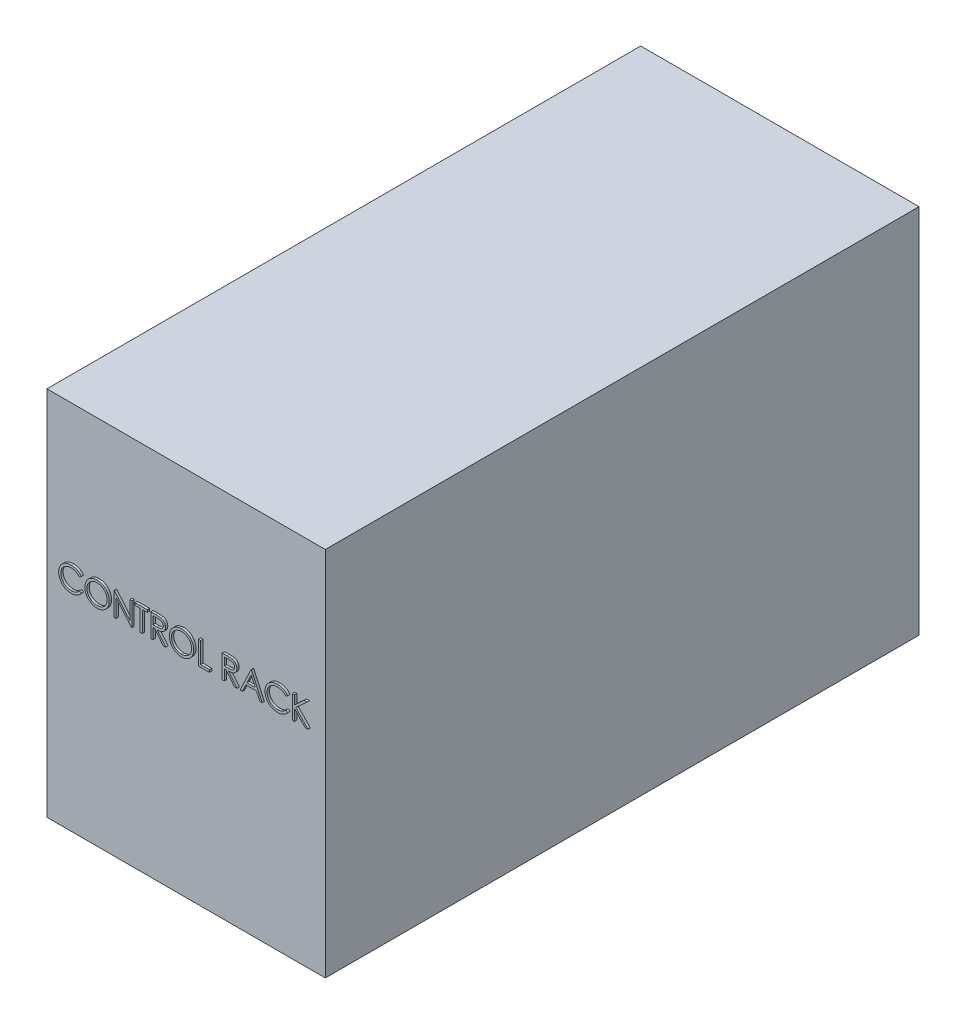
from build123d import *

# Parameters (mm, degrees)
SKETCH1_W           = 600
SKETCH1_H           = 800
BOSS_EXTRUDE1_DEPTH = 1280
BOSS_EXTRUDE2_DEPTH = 5


with BuildPart() as part:
    # Sketch1 → Boss-Extrude1 (new body)
    with BuildSketch(Plane.XY):
        with Locations((-300, 400)):
            Rectangle(SKETCH1_W, SKETCH1_H)
    extrude(amount=BOSS_EXTRUDE1_DEPTH)

    # Sketch2 → Boss-Extrude2 (add)
    # profile 1 of 11: a face of its own
    with BuildSketch(Plane.XY.offset(1280)):
        with BuildLine():
            Line((-520.987509976, 491.534086131), (-524.913792027, 488.529278439))
            add(Edge.make_bspline(
                [(-524.913792027, 488.529278439), (-525.193876147, 488.863078008), (-525.750268244, 489.526176804), (-526.645399709, 490.457313153), (-527.578280321, 491.329674031), (-528.548553482, 492.147415168), (-529.57368376, 492.881940393), (-530.628838027, 493.571527578), (-531.731667244, 494.18963812), (-533.256692025, 494.93910935), (-535.251661286, 495.721197279), (-537.76301613, 496.376957726), (-540.384603251, 496.794403093), (-542.173140388, 496.839615114), (-543.08286254, 496.862611772)],
                knots=[0, 0, 0, 0, 0.757959112, 1.505699292, 2.245454638, 2.979532153, 3.711538275, 4.438200793, 5.171680507, 5.909471876, 7.393775596, 8.890124382, 10.418191784, 12, 12, 12, 12], degree=3))
            add(Edge.make_bspline(
                [(-543.08286254, 496.862611772), (-543.584052531, 496.856840879), (-544.581780996, 496.845352652), (-546.062473474, 496.693793721), (-547.515517062, 496.480776434), (-548.939966579, 496.164700388), (-550.334008844, 495.765091544), (-551.706757445, 495.287585631), (-553.038337442, 494.696802205), (-554.347169417, 494.043827062), (-555.601158145, 493.306292138), (-556.787658828, 492.501815682), (-557.902344084, 491.639400019), (-558.946095686, 490.715812785), (-559.919980662, 489.735213349), (-560.816942245, 488.687151327), (-561.633876677, 487.574977419), (-562.386977035, 486.413357311), (-563.061444655, 485.205674574), (-563.626157217, 483.947459282), (-564.126230392, 482.66025781), (-564.521933858, 481.329526941), (-564.835141241, 479.964630286), (-565.051250717, 478.561904744), (-565.20108602, 477.124280749), (-565.212517118, 476.149861998), (-565.218279207, 475.65868549)],
                knots=[0, 0, 0, 0, 1.054917814, 2.100044995, 3.131103042, 4.146048494, 5.169673617, 6.183595914, 7.203665975, 8.234915748, 9.262203917, 10.264457458, 11.251630812, 12.227803204, 13.197192746, 14.159520551, 15.12972552, 16.100847026, 17.073214652, 18.039054194, 19.002613845, 19.979014051, 20.95965708, 21.949030935, 22.966165397, 24, 24, 24, 24], degree=3))
            add(Edge.make_bspline(
                [(-565.218279207, 475.65868549), (-565.200253221, 474.919666634), (-565.164861588, 473.468701136), (-564.849885387, 471.3434067), (-564.371241226, 469.307397074), (-563.653875841, 467.373399327), (-562.769317976, 465.51756564), (-561.651594954, 463.771296306), (-560.357072992, 462.108202527), (-558.867438428, 460.567588988), (-557.233069628, 459.160250055), (-555.479528034, 457.920956034), (-553.611181066, 456.887886284), (-551.648657777, 456.028229905), (-549.57685615, 455.36741951), (-547.39950183, 454.902217746), (-545.121330469, 454.598758024), (-543.564624756, 454.569705337), (-542.772365745, 454.554919464)],
                knots=[0, 0, 0, 0, 1.029171465, 2.020641659, 2.987623507, 3.938342917, 4.889210282, 5.84687017, 6.821220943, 7.821438502, 8.827599549, 9.822697543, 10.807740252, 11.797342354, 12.80366471, 13.83203677, 14.896651826, 16, 16, 16, 16], degree=3))
            add(Edge.make_bspline(
                [(-542.772365745, 454.554919464), (-541.899470188, 454.579044889), (-540.181402918, 454.626529497), (-537.661859684, 455.028804484), (-535.249920175, 455.681060454), (-532.945454653, 456.593887915), (-530.754959708, 457.780534885), (-528.675007417, 459.219075991), (-526.703842125, 460.923195031), (-525.518538093, 462.224382577), (-524.913792027, 462.888252798)],
                knots=[0, 0, 0, 0, 1.028121516, 2.023589091, 2.998037872, 3.967518031, 4.937445131, 5.927275754, 6.942489185, 8, 8, 8, 8], degree=3))
            Line((-524.913792027, 462.888252798), (-520.987509976, 459.913493182))
            add(Edge.make_bspline(
                [(-520.987509976, 459.913493182), (-521.303482974, 459.505801012), (-521.933915478, 458.692369494), (-522.954744292, 457.545630783), (-524.030134255, 456.467001705), (-525.168072969, 455.465178544), (-526.355469992, 454.52011475), (-527.613645883, 453.658660018), (-528.926060633, 452.868790242), (-530.288267474, 452.145548463), (-531.698819086, 451.503873506), (-533.156025299, 450.954533966), (-534.653604949, 450.481321258), (-536.191626498, 450.092007877), (-537.773280167, 449.78813525), (-539.392858368, 449.584997038), (-541.053856586, 449.445826832), (-542.174448316, 449.43314232), (-542.742317668, 449.426714336)],
                knots=[0, 0, 0, 0, 0.986787822, 1.968848986, 2.935600012, 3.899624008, 4.868462664, 5.837806735, 6.815139263, 7.798259679, 8.787526145, 9.778297419, 10.776456485, 11.791383307, 12.812564526, 13.85620153, 14.913611965, 16, 16, 16, 16], degree=3))
            add(Edge.make_bspline(
                [(-542.742317668, 449.426714336), (-543.28008434, 449.430457087), (-544.343451342, 449.437857913), (-545.913433508, 449.557746019), (-547.441856091, 449.721313689), (-548.924350746, 449.967601276), (-550.369007532, 450.258234705), (-551.762730168, 450.647824085), (-553.119233173, 451.084240751), (-554.433066611, 451.597169133), (-555.705348037, 452.175971741), (-556.931973914, 452.830136868), (-558.112380091, 453.554163506), (-559.258171817, 454.332092226), (-560.352423013, 455.188910825), (-561.404616232, 456.112719889), (-562.420651607, 457.100405757), (-563.049261392, 457.812617947), (-563.365314463, 458.170704721)],
                knots=[0, 0, 0, 0, 1.114604814, 2.203992996, 3.262667896, 4.300477797, 5.318619304, 6.316056647, 7.298880507, 8.271930387, 9.238335007, 10.195173496, 11.151986948, 12.108099108, 13.064862484, 14.031167946, 15.010108607, 16, 16, 16, 16], degree=3))
            add(Edge.make_bspline(
                [(-563.365314463, 458.170704721), (-563.871537942, 458.792721705), (-564.877873325, 460.02924614), (-566.16538309, 462.033331586), (-567.267491021, 464.12573457), (-568.158575604, 466.317447838), (-568.855186078, 468.60355337), (-569.337774579, 470.985203576), (-569.651368928, 473.460174179), (-569.687230197, 475.143556874), (-569.705458694, 475.999230362)],
                knots=[0, 0, 0, 0, 0.994628077, 1.977248131, 2.950237994, 3.925870899, 4.908910175, 5.911660606, 6.938484602, 8, 8, 8, 8], degree=3))
            add(Edge.make_bspline(
                [(-569.705458694, 475.999230362), (-569.683241643, 476.898593984), (-569.639530983, 478.668035763), (-569.268162476, 481.264806524), (-568.670751102, 483.752683651), (-567.822224122, 486.127022859), (-566.746433389, 488.400312577), (-565.417481762, 490.555186932), (-563.850808302, 492.605426927), (-562.058700192, 494.519923374), (-560.093452545, 496.270485554), (-557.988898061, 497.810574179), (-555.749155962, 499.092252979), (-553.398900938, 500.163626728), (-550.920534058, 500.987119059), (-548.319343071, 501.563593154), (-545.600215717, 501.922409101), (-543.745038207, 501.967769214), (-542.802413822, 501.9908169)],
                knots=[0, 0, 0, 0, 1.032925535, 2.032216505, 3.007276963, 3.968222605, 4.92396291, 5.891752235, 6.871517503, 7.883894988, 8.900124299, 9.891468569, 10.874487609, 11.85992873, 12.854644235, 13.869047385, 14.917252991, 16, 16, 16, 16], degree=3))
            add(Edge.make_bspline(
                [(-542.802413822, 501.9908169), (-542.227921366, 501.983929212), (-541.090771404, 501.970295726), (-539.408590656, 501.837350839), (-537.770843128, 501.615727893), (-536.176400527, 501.314069752), (-534.61750601, 500.939679446), (-533.106073998, 500.451960898), (-531.633235614, 499.894296165), (-530.208279783, 499.252032366), (-528.838043352, 498.531078918), (-527.522953088, 497.739427153), (-526.273455106, 496.878058503), (-525.080757271, 495.954298854), (-523.964811399, 494.94860515), (-522.893933134, 493.888639493), (-521.90448916, 492.743870576), (-521.293729232, 491.938085806), (-520.987509976, 491.534086131)],
                knots=[0, 0, 0, 0, 1.096760587, 2.17092713, 3.219439832, 4.250915756, 5.268269357, 6.278326846, 7.281116186, 8.274029601, 9.260640565, 10.235837813, 11.203064059, 12.156899882, 13.114053108, 14.069676657, 15.032185724, 16, 16, 16, 16], degree=3))
        make_face()
    # profile 2 of 11: a face of its own
    with BuildSketch(Plane.XY.offset(1280)):
        with BuildLine():
            add(Edge.make_bspline(
                [(-487.333663822, 501.9908169), (-486.407833738, 501.967367195), (-484.589427067, 501.921310039), (-481.916928528, 501.568751417), (-479.365570024, 500.958817274), (-476.914568041, 500.146488953), (-474.593239804, 499.062854876), (-472.384112769, 497.753067043), (-470.292443143, 496.203403346), (-468.346423406, 494.425842963), (-466.565609831, 492.491793621), (-464.996668599, 490.427823477), (-463.681778688, 488.246412016), (-462.601981729, 485.954114435), (-461.754858733, 483.556114893), (-461.170300966, 481.039629139), (-460.796898821, 478.420962138), (-460.753244858, 476.634864071), (-460.731099719, 475.728797669)],
                knots=[0, 0, 0, 0, 1.065120563, 2.091984664, 3.0946048, 4.079830382, 5.057816894, 6.036188127, 7.030412546, 8.04752943, 9.064399622, 10.05169764, 11.02544977, 11.989514704, 12.962713494, 13.945757189, 14.957906945, 16, 16, 16, 16], degree=3))
            add(Edge.make_bspline(
                [(-460.731099719, 475.728797669), (-460.753241613, 474.829405579), (-460.796885849, 473.056599572), (-461.170725528, 470.45455037), (-461.757025528, 467.953254706), (-462.594115045, 465.556888238), (-463.668764737, 463.262923041), (-464.992410039, 461.077395128), (-466.551570193, 458.999588009), (-468.325953779, 457.05226422), (-470.260254379, 455.266586067), (-472.334972476, 453.710602129), (-474.503448475, 452.371686063), (-476.793587163, 451.303347863), (-479.175016261, 450.449463286), (-481.669049448, 449.867282857), (-484.26400022, 449.491753667), (-486.033585988, 449.448632011), (-486.933022796, 449.426714336)],
                knots=[0, 0, 0, 0, 1.043624062, 2.057103931, 3.04512605, 4.022047818, 4.998200453, 5.980619268, 6.982898556, 8.009068085, 9.034988726, 10.034168286, 11.015286542, 11.987931943, 12.962482838, 13.94673481, 14.956375938, 16, 16, 16, 16], degree=3))
            add(Edge.make_bspline(
                [(-486.933022796, 449.426714336), (-487.839084496, 449.448848434), (-489.625173295, 449.492480633), (-492.247130944, 449.866500702), (-494.765384427, 450.45137647), (-497.172732302, 451.287225559), (-499.47051701, 452.367471712), (-501.663232477, 453.684677127), (-503.742077438, 455.247636287), (-505.689816673, 457.021444495), (-507.471948076, 458.952466667), (-509.025653443, 461.021527454), (-510.343155062, 463.188033977), (-511.419774097, 465.457998608), (-512.272123517, 467.820447789), (-512.853620919, 470.291140325), (-513.229848805, 472.855990408), (-513.273203755, 474.602317527), (-513.295202284, 475.488413054)],
                knots=[0, 0, 0, 0, 1.053102029, 2.075944431, 3.073151272, 4.055350789, 5.033113405, 6.020478099, 7.024410459, 8.052272461, 9.079885166, 10.07527673, 11.055994387, 12.023226415, 12.992069828, 13.970394897, 14.97016774, 16, 16, 16, 16], degree=3))
            add(Edge.make_bspline(
                [(-513.295202284, 475.488413054), (-513.287564634, 476.08316547), (-513.272385686, 477.265167235), (-513.089647222, 479.02040438), (-512.824480062, 480.747413776), (-512.44445274, 482.441284462), (-511.947428926, 484.097869957), (-511.360971391, 485.728595141), (-510.644687886, 487.316934051), (-509.834964343, 488.870411076), (-508.931224228, 490.364809731), (-507.932999236, 491.777375204), (-506.875351115, 493.119960872), (-505.715874063, 494.357775213), (-504.492781989, 495.526827447), (-503.18623373, 496.609151976), (-501.804201668, 497.614508418), (-500.3407391, 498.520513291), (-498.831906601, 499.3399295), (-497.276524062, 500.043098799), (-495.695715897, 500.646613964), (-494.08207807, 501.13576861), (-492.439895611, 501.521940552), (-490.765584403, 501.784902748), (-489.060478314, 501.968107289), (-487.911745186, 501.983214461), (-487.333663822, 501.9908169)],
                knots=[0, 0, 0, 0, 1.037015668, 2.060948919, 3.074880161, 4.083647147, 5.086022904, 6.090072063, 7.104153813, 8.122640571, 9.144368836, 10.147691507, 11.138137339, 12.123020368, 13.103399296, 14.087645067, 15.080126199, 16.082011238, 17.087798457, 18.072939717, 19.057185487, 20.037253025, 21.01195951, 21.997135196, 22.992090687, 24, 24, 24, 24], degree=3))
        make_face()
        with BuildLine():
            add(Edge.make_bspline(
                [(-487.113311258, 496.862611772), (-487.587806023, 496.856827625), (-488.532259351, 496.845314629), (-489.936324154, 496.69366155), (-491.321923209, 496.477520279), (-492.689342668, 496.169212839), (-494.032861088, 495.749154942), (-495.365001676, 495.265713397), (-496.673616731, 494.676840674), (-497.954386129, 494.011516326), (-499.19603006, 493.275103172), (-500.367640081, 492.461220785), (-501.47224928, 491.588955725), (-502.50715309, 490.656272334), (-503.469312692, 489.65842088), (-504.37766557, 488.610528935), (-505.195802451, 487.482644777), (-505.945596405, 486.305353251), (-506.616565552, 485.080187805), (-507.213213477, 483.820046915), (-507.701270745, 482.51465139), (-508.099304692, 481.178163424), (-508.42930199, 479.812699715), (-508.638358049, 478.407901874), (-508.791677469, 476.970828845), (-508.802532404, 475.999659502), (-508.808022796, 475.508445105)],
                knots=[0, 0, 0, 0, 1.008559885, 2.007477868, 2.99961109, 3.989939068, 4.984837346, 5.991145699, 7.001802488, 8.033829008, 9.059044045, 10.069351652, 11.065060232, 12.050310815, 13.029377138, 14.011219647, 14.996725999, 15.989392538, 16.977580475, 17.965360261, 18.951710183, 19.937753436, 20.929683414, 21.935841486, 22.955955122, 24, 24, 24, 24], degree=3))
            add(Edge.make_bspline(
                [(-508.808022796, 475.508445105), (-508.789810483, 474.786127665), (-508.753981228, 473.365105804), (-508.440301654, 471.282703749), (-507.957130591, 469.281442515), (-507.244882499, 467.372272383), (-506.354159432, 465.538782628), (-505.253775286, 463.797238275), (-503.950074063, 462.147168641), (-502.46916654, 460.60009337), (-500.850270732, 459.188010453), (-499.131231733, 457.948533186), (-497.330465911, 456.899815332), (-495.443277301, 456.045457155), (-493.479741029, 455.368460901), (-491.427204586, 454.904480456), (-489.299340878, 454.599116808), (-487.848902947, 454.569791723), (-487.113311258, 454.554919464)],
                knots=[0, 0, 0, 0, 1.032063989, 2.030389145, 3.003944642, 3.970395727, 4.937377036, 5.913328081, 6.909231446, 7.93887556, 8.970685674, 9.976071282, 10.964166581, 11.944589148, 12.933237628, 13.927779006, 14.949070134, 16, 16, 16, 16], degree=3))
            add(Edge.make_bspline(
                [(-487.113311258, 454.554919464), (-486.618889806, 454.561712384), (-485.638303572, 454.575184783), (-484.17979611, 454.710880167), (-482.747564514, 454.928478301), (-481.343617659, 455.241773381), (-479.969548925, 455.63387633), (-478.619623166, 456.099701016), (-477.308219018, 456.680861068), (-476.018792764, 457.322974662), (-474.78456074, 458.054976913), (-473.60633885, 458.841236193), (-472.513824852, 459.712216489), (-471.47969526, 460.631042383), (-470.513585418, 461.616240209), (-469.6220285, 462.666529093), (-468.808026612, 463.788538482), (-468.058517375, 464.964044278), (-467.389899336, 466.192562174), (-466.807340778, 467.457271859), (-466.313110552, 468.755059135), (-465.914131911, 470.087795871), (-465.601482459, 471.452950853), (-465.386055031, 472.85235197), (-465.235363051, 474.28319972), (-465.224004805, 475.250969091), (-465.218279207, 475.738813695)],
                knots=[0, 0, 0, 0, 1.047197238, 2.076906641, 3.100256066, 4.114471768, 5.12198147, 6.126382909, 7.136867548, 8.15857795, 9.17633901, 10.174870724, 11.156907918, 12.133735059, 13.104061851, 14.077631395, 15.04955518, 16.038496417, 17.029181396, 18.010275684, 18.986308667, 19.968651475, 20.955262928, 21.950658345, 22.966943676, 24, 24, 24, 24], degree=3))
            add(Edge.make_bspline(
                [(-465.218279207, 475.738813695), (-465.224009392, 476.223320899), (-465.23537627, 477.184430187), (-465.385983051, 478.605299021), (-465.601710056, 479.994630613), (-465.912605885, 481.346970656), (-466.313322367, 482.662663871), (-466.807427087, 483.940474553), (-467.390074222, 485.185163054), (-468.058763142, 486.393653011), (-468.810417763, 487.553292125), (-469.631764096, 488.661898018), (-470.536983355, 489.698651466), (-471.500212282, 490.689147095), (-472.545510644, 491.612259804), (-473.668143416, 492.468295813), (-474.85448167, 493.277914017), (-476.110585033, 494.008279186), (-477.40692723, 494.682768225), (-478.737126629, 495.260639699), (-480.086113767, 495.751669975), (-481.450458229, 496.170483762), (-482.841643633, 496.476312764), (-484.25026976, 496.693856333), (-485.674387739, 496.845261846), (-486.632148021, 496.856810111), (-487.113311258, 496.862611772)],
                knots=[0, 0, 0, 0, 1.02996197, 2.043119294, 3.035359645, 4.018872909, 4.991431989, 5.957985074, 6.929999688, 7.912076566, 8.892894881, 9.867085534, 10.843653904, 11.817741046, 12.803660682, 13.806313499, 14.818574707, 15.856120519, 16.894564902, 17.924820532, 18.937903209, 19.946497019, 20.957711757, 21.963978472, 22.977135795, 24, 24, 24, 24], degree=3))
        make_face(mode=Mode.SUBTRACT)
    # profile 3 of 11: a face of its own
    with BuildSketch(Plane.XY.offset(1280)):
        Polygon((-450.474689463, 450.708765618), (-450.474689463, 500.708765618), (-449.533183053, 500.708765618), (-416.500330489, 461.355800875), (-416.500330489, 500.708765618), (-412.013151002, 500.708765618), (-412.013151002, 450.708765618), (-413.034785617, 450.708765618), (-445.987509976, 489.971586131), (-445.987509976, 450.708765618), align=None)
    # profile 4 of 11: a face of its own
    with BuildSketch(Plane.XY.offset(1280)):
        Polygon((-404.96186895, 495.58056049), (-404.96186895, 500.708765618), (-378.679817668, 500.708765618), (-378.679817668, 495.58056049), (-389.577253566, 495.58056049), (-389.577253566, 450.708765618), (-394.064433053, 450.708765618), (-394.064433053, 495.58056049), align=None)
    # profile 5 of 11: a face of its own
    with BuildSketch(Plane.XY.offset(1280)):
        with BuildLine():
            Line((-370.987509976, 500.708765618), (-360.98150036, 500.708765618))
            add(Edge.make_bspline(
                [(-360.98150036, 500.708765618), (-360.313769953, 500.706542961), (-359.031653604, 500.702275214), (-357.194892599, 500.678478601), (-355.525934071, 500.610273519), (-354.025650652, 500.551579469), (-352.694069867, 500.444551736), (-351.52710857, 500.342256777), (-350.530141463, 500.208347338), (-349.926629302, 500.083984152), (-349.65337536, 500.027675875)],
                knots=[0, 0, 0, 0, 1.410062039, 2.707475311, 3.878576406, 4.937260626, 5.877586885, 6.699081471, 7.410979367, 8, 8, 8, 8], degree=3))
            add(Edge.make_bspline(
                [(-349.65337536, 500.027675875), (-349.287566444, 499.937293512), (-348.563752309, 499.758456889), (-347.521608508, 499.380462591), (-346.528546738, 498.943039382), (-345.588692104, 498.429271949), (-344.70675223, 497.835346525), (-343.873633505, 497.171516205), (-343.085555456, 496.441413265), (-342.374389311, 495.626629815), (-341.70383143, 494.771822534), (-341.138279622, 493.84748315), (-340.650758484, 492.8808899), (-340.262608241, 491.862212504), (-339.950065763, 490.801330048), (-339.729690914, 489.688632952), (-339.597531091, 488.529190451), (-339.584076012, 487.738363183), (-339.577253566, 487.337371387)],
                knots=[0, 0, 0, 0, 1.027469482, 2.033020251, 3.019912614, 3.986113645, 4.951240523, 5.91722682, 6.890402269, 7.87763091, 8.8651537, 9.85103654, 10.82876324, 11.815024772, 12.821070561, 13.842952187, 14.906261191, 16, 16, 16, 16], degree=3))
            add(Edge.make_bspline(
                [(-339.577253566, 487.337371387), (-339.598239253, 486.671155607), (-339.639187764, 485.371196066), (-340.02097496, 483.484612046), (-340.646353813, 481.724764694), (-341.508115084, 480.093869866), (-342.605536166, 478.62371779), (-343.924461753, 477.332425571), (-345.465627632, 476.251855391), (-346.900332145, 475.50252961), (-348.167677855, 475.022630915), (-349.211010895, 474.684968646), (-350.349110573, 474.424083428), (-351.571072496, 474.190367259), (-352.88198186, 474.013914482), (-354.278696709, 473.884677418), (-355.762213161, 473.803905294), (-356.781342723, 473.791876653), (-357.30561895, 473.785688695)],
                knots=[0, 0, 0, 0, 1.260483769, 2.459530307, 3.627416485, 4.787058657, 5.939039949, 7.08810263, 8.267026773, 9.491475466, 10.141966685, 10.831826277, 11.566392101, 12.351337768, 13.187381173, 14.07005841, 15.007169909, 16, 16, 16, 16], degree=3))
            Line((-357.30561895, 473.785688695), (-338.936227925, 450.708765618))
            Line((-338.936227925, 450.708765618), (-344.48510613, 450.708765618))
            Line((-344.48510613, 450.708765618), (-362.854497155, 473.785688695))
            Line((-362.854497155, 473.785688695), (-366.500330489, 473.785688695))
            Line((-366.500330489, 473.785688695), (-366.500330489, 450.708765618))
            Line((-366.500330489, 450.708765618), (-370.987509976, 450.708765618))
            Line((-370.987509976, 450.708765618), (-370.987509976, 500.708765618))
        make_face()
        with BuildLine():
            Line((-366.500330489, 495.58056049), (-366.500330489, 478.913893823))
            Line((-366.500330489, 478.913893823), (-357.345683053, 478.843781644))
            add(Edge.make_bspline(
                [(-357.345683053, 478.843781644), (-356.918253925, 478.843592549), (-356.089774538, 478.843226029), (-354.891193612, 478.900279975), (-353.775192016, 478.965184521), (-352.746038414, 479.064460886), (-351.803273052, 479.192404768), (-350.947367149, 479.3524474), (-350.176923551, 479.538905438), (-349.278373002, 479.827500092), (-348.274993982, 480.284728924), (-347.184544556, 480.949950334), (-346.255939731, 481.786652037), (-345.47139884, 482.743415694), (-344.840978391, 483.795362106), (-344.396520472, 484.929881667), (-344.114485582, 486.118333067), (-344.081220647, 486.935163179), (-344.064433053, 487.347387413)],
                knots=[0, 0, 0, 0, 1.146690395, 2.22261258, 3.21895312, 4.145990853, 4.996080663, 5.770904154, 6.481378293, 7.121626537, 8.300444488, 9.431385265, 10.535395872, 11.636531494, 12.74115979, 13.810798291, 14.895190096, 16, 16, 16, 16], degree=3))
            add(Edge.make_bspline(
                [(-344.064433053, 487.347387413), (-344.081606211, 487.749481323), (-344.115637145, 488.546284733), (-344.393476695, 489.712797737), (-344.863325, 490.813754168), (-345.496499828, 491.844675382), (-346.267916327, 492.780471608), (-347.172456509, 493.581145223), (-348.185387868, 494.241851862), (-349.132119273, 494.664057298), (-349.978322309, 494.922912344), (-350.713031738, 495.105071827), (-351.543195705, 495.251421383), (-352.472845114, 495.368679396), (-353.498011268, 495.469464313), (-354.623877712, 495.537346866), (-355.842974573, 495.577544924), (-356.687930733, 495.579531908), (-357.125330489, 495.58056049)],
                knots=[0, 0, 0, 0, 1.101028733, 2.181837193, 3.264309656, 4.369019818, 5.486613113, 6.575447106, 7.666700264, 8.788928104, 9.402425223, 10.0903467, 10.862060571, 11.710948788, 12.657782767, 13.684531032, 14.801375019, 16, 16, 16, 16], degree=3))
            Line((-357.125330489, 495.58056049), (-366.500330489, 495.58056049))
        make_face(mode=Mode.SUBTRACT)
    # profile 6 of 11: a face of its own
    with BuildSketch(Plane.XY.offset(1280)):
        with BuildLine():
            add(Edge.make_bspline(
                [(-305.282381771, 501.9908169), (-304.356551686, 501.967367195), (-302.538145016, 501.921310039), (-299.865646477, 501.568751417), (-297.314287973, 500.958817274), (-294.86328599, 500.146488953), (-292.541957753, 499.062854876), (-290.332830717, 497.753067043), (-288.241161091, 496.203403346), (-286.295141355, 494.425842963), (-284.51432778, 492.491793621), (-282.945386547, 490.427823477), (-281.630496637, 488.246412016), (-280.550699677, 485.954114435), (-279.703576682, 483.556114893), (-279.119018915, 481.039629139), (-278.74561677, 478.420962138), (-278.701962807, 476.634864071), (-278.679817668, 475.728797669)],
                knots=[0, 0, 0, 0, 1.065120563, 2.091984664, 3.0946048, 4.079830382, 5.057816894, 6.036188127, 7.030412546, 8.04752943, 9.064399622, 10.05169764, 11.02544977, 11.989514704, 12.962713494, 13.945757189, 14.957906945, 16, 16, 16, 16], degree=3))
            add(Edge.make_bspline(
                [(-278.679817668, 475.728797669), (-278.701959561, 474.829405579), (-278.745603798, 473.056599572), (-279.119443477, 470.45455037), (-279.705743477, 467.953254706), (-280.542832994, 465.556888238), (-281.617482686, 463.262923041), (-282.941127988, 461.077395128), (-284.500288141, 458.999588009), (-286.274671728, 457.05226422), (-288.208972328, 455.266586067), (-290.283690425, 453.710602129), (-292.452166424, 452.371686063), (-294.742305112, 451.303347863), (-297.123734209, 450.449463286), (-299.617767396, 449.867282857), (-302.212718168, 449.491753667), (-303.982303937, 449.448632011), (-304.881740745, 449.426714336)],
                knots=[0, 0, 0, 0, 1.043624062, 2.057103931, 3.04512605, 4.022047818, 4.998200453, 5.980619268, 6.982898556, 8.009068085, 9.034988726, 10.034168286, 11.015286542, 11.987931943, 12.962482838, 13.94673481, 14.956375938, 16, 16, 16, 16], degree=3))
            add(Edge.make_bspline(
                [(-304.881740745, 449.426714336), (-305.787802445, 449.448848434), (-307.573891244, 449.492480633), (-310.195848892, 449.866500702), (-312.714102376, 450.45137647), (-315.12145025, 451.287225559), (-317.419234959, 452.367471712), (-319.611950426, 453.684677127), (-321.690795386, 455.247636287), (-323.638534622, 457.021444495), (-325.420666025, 458.952466667), (-326.974371392, 461.021527454), (-328.29187301, 463.188033977), (-329.368492046, 465.457998608), (-330.220841465, 467.820447789), (-330.802338867, 470.291140325), (-331.178566754, 472.855990408), (-331.221921704, 474.602317527), (-331.243920232, 475.488413054)],
                knots=[0, 0, 0, 0, 1.053102029, 2.075944431, 3.073151272, 4.055350789, 5.033113405, 6.020478099, 7.024410459, 8.052272461, 9.079885166, 10.07527673, 11.055994387, 12.023226415, 12.992069828, 13.970394897, 14.97016774, 16, 16, 16, 16], degree=3))
            add(Edge.make_bspline(
                [(-331.243920232, 475.488413054), (-331.236282582, 476.08316547), (-331.221103634, 477.265167235), (-331.038365171, 479.02040438), (-330.773198011, 480.747413776), (-330.393170688, 482.441284462), (-329.896146874, 484.097869957), (-329.30968934, 485.728595141), (-328.593405835, 487.316934051), (-327.783682292, 488.870411076), (-326.879942177, 490.364809731), (-325.881717185, 491.777375204), (-324.824069064, 493.119960872), (-323.664592012, 494.357775213), (-322.441499938, 495.526827447), (-321.134951679, 496.609151976), (-319.752919616, 497.614508418), (-318.289457048, 498.520513291), (-316.78062455, 499.3399295), (-315.22524201, 500.043098799), (-313.644433846, 500.646613964), (-312.030796018, 501.13576861), (-310.38861356, 501.521940552), (-308.714302352, 501.784902748), (-307.009196262, 501.968107289), (-305.860463134, 501.983214461), (-305.282381771, 501.9908169)],
                knots=[0, 0, 0, 0, 1.037015668, 2.060948919, 3.074880161, 4.083647147, 5.086022904, 6.090072063, 7.104153813, 8.122640571, 9.144368836, 10.147691507, 11.138137339, 12.123020368, 13.103399296, 14.087645067, 15.080126199, 16.082011238, 17.087798457, 18.072939717, 19.057185487, 20.037253025, 21.01195951, 21.997135196, 22.992090687, 24, 24, 24, 24], degree=3))
        make_face()
        with BuildLine():
            add(Edge.make_bspline(
                [(-305.062029207, 496.862611772), (-305.536523972, 496.856827625), (-306.480977299, 496.845314629), (-307.885042103, 496.69366155), (-309.270641157, 496.477520279), (-310.638060617, 496.169212839), (-311.981579037, 495.749154942), (-313.313719625, 495.265713397), (-314.62233468, 494.676840674), (-315.903104078, 494.011516326), (-317.144748009, 493.275103172), (-318.31635803, 492.461220785), (-319.420967229, 491.588955725), (-320.455871038, 490.656272334), (-321.418030641, 489.65842088), (-322.326383519, 488.610528935), (-323.144520399, 487.482644777), (-323.894314354, 486.305353251), (-324.565283501, 485.080187805), (-325.161931426, 483.820046915), (-325.649988694, 482.51465139), (-326.048022641, 481.178163424), (-326.378019939, 479.812699715), (-326.587075997, 478.407901874), (-326.740395418, 476.970828845), (-326.751250353, 475.999659502), (-326.756740745, 475.508445105)],
                knots=[0, 0, 0, 0, 1.008559885, 2.007477868, 2.99961109, 3.989939068, 4.984837346, 5.991145699, 7.001802488, 8.033829008, 9.059044045, 10.069351652, 11.065060232, 12.050310815, 13.029377138, 14.011219647, 14.996725999, 15.989392538, 16.977580475, 17.965360261, 18.951710183, 19.937753436, 20.929683414, 21.935841486, 22.955955122, 24, 24, 24, 24], degree=3))
            add(Edge.make_bspline(
                [(-326.756740745, 475.508445105), (-326.738528431, 474.786127665), (-326.702699176, 473.365105804), (-326.389019603, 471.282703749), (-325.90584854, 469.281442515), (-325.193600448, 467.372272383), (-324.302877381, 465.538782628), (-323.202493234, 463.797238275), (-321.898792012, 462.147168641), (-320.417884489, 460.60009337), (-318.79898868, 459.188010453), (-317.079949681, 457.948533186), (-315.27918386, 456.899815332), (-313.39199525, 456.045457155), (-311.428458978, 455.368460901), (-309.375922535, 454.904480456), (-307.248058826, 454.599116808), (-305.797620896, 454.569791723), (-305.062029207, 454.554919464)],
                knots=[0, 0, 0, 0, 1.032063989, 2.030389145, 3.003944642, 3.970395727, 4.937377036, 5.913328081, 6.909231446, 7.93887556, 8.970685674, 9.976071282, 10.964166581, 11.944589148, 12.933237628, 13.927779006, 14.949070134, 16, 16, 16, 16], degree=3))
            add(Edge.make_bspline(
                [(-305.062029207, 454.554919464), (-304.567607755, 454.561712384), (-303.587021521, 454.575184783), (-302.128514059, 454.710880167), (-300.696282463, 454.928478301), (-299.292335607, 455.241773381), (-297.918266873, 455.63387633), (-296.568341114, 456.099701016), (-295.256936967, 456.680861068), (-293.967510713, 457.322974662), (-292.733278689, 458.054976913), (-291.555056799, 458.841236193), (-290.462542801, 459.712216489), (-289.428413209, 460.631042383), (-288.462303366, 461.616240209), (-287.570746449, 462.666529093), (-286.756744561, 463.788538482), (-286.007235324, 464.964044278), (-285.338617284, 466.192562174), (-284.756058726, 467.457271859), (-284.2618285, 468.755059135), (-283.86284986, 470.087795871), (-283.550200407, 471.452950853), (-283.33477298, 472.85235197), (-283.184080999, 474.28319972), (-283.172722754, 475.250969091), (-283.166997155, 475.738813695)],
                knots=[0, 0, 0, 0, 1.047197238, 2.076906641, 3.100256066, 4.114471768, 5.12198147, 6.126382909, 7.136867548, 8.15857795, 9.17633901, 10.174870724, 11.156907918, 12.133735059, 13.104061851, 14.077631395, 15.04955518, 16.038496417, 17.029181396, 18.010275684, 18.986308667, 19.968651475, 20.955262928, 21.950658345, 22.966943676, 24, 24, 24, 24], degree=3))
            add(Edge.make_bspline(
                [(-283.166997155, 475.738813695), (-283.172727341, 476.223320899), (-283.184094219, 477.184430187), (-283.334700999, 478.605299021), (-283.550428005, 479.994630613), (-283.861323834, 481.346970656), (-284.262040316, 482.662663871), (-284.756145036, 483.940474553), (-285.338792171, 485.185163054), (-286.007481091, 486.393653011), (-286.759135712, 487.553292125), (-287.580482045, 488.661898018), (-288.485701304, 489.698651466), (-289.448930231, 490.689147095), (-290.494228593, 491.612259804), (-291.616861365, 492.468295813), (-292.803199619, 493.277914017), (-294.059302982, 494.008279186), (-295.355645178, 494.682768225), (-296.685844578, 495.260639699), (-298.034831715, 495.751669975), (-299.399176177, 496.170483762), (-300.790361582, 496.476312764), (-302.198987708, 496.693856333), (-303.623105688, 496.845261846), (-304.58086597, 496.856810111), (-305.062029207, 496.862611772)],
                knots=[0, 0, 0, 0, 1.02996197, 2.043119294, 3.035359645, 4.018872909, 4.991431989, 5.957985074, 6.929999688, 7.912076566, 8.892894881, 9.867085534, 10.843653904, 11.817741046, 12.803660682, 13.806313499, 14.818574707, 15.856120519, 16.894564902, 17.924820532, 18.937903209, 19.946497019, 20.957711757, 21.963978472, 22.977135795, 24, 24, 24, 24], degree=3))
        make_face(mode=Mode.SUBTRACT)
    # profile 7 of 11: a face of its own
    with BuildSketch(Plane.XY.offset(1280)):
        Polygon((-268.423407412, 500.708765618), (-263.936227925, 500.708765618), (-263.936227925, 455.836970746), (-244.705458694, 455.836970746), (-244.705458694, 450.708765618), (-268.423407412, 450.708765618), align=None)
    # profile 8 of 11: a face of its own
    with BuildSketch(Plane.XY.offset(1280)):
        with BuildLine():
            Line((-217.14135613, 500.708765618), (-207.135346514, 500.708765618))
            add(Edge.make_bspline(
                [(-207.135346514, 500.708765618), (-206.467616107, 500.706542961), (-205.185499758, 500.702275214), (-203.348738753, 500.678478601), (-201.679780225, 500.610273519), (-200.179496806, 500.551579469), (-198.84791602, 500.444551736), (-197.680954724, 500.342256777), (-196.683987617, 500.208347338), (-196.080475455, 500.083984152), (-195.807221514, 500.027675875)],
                knots=[0, 0, 0, 0, 1.410062039, 2.707475311, 3.878576406, 4.937260626, 5.877586885, 6.699081471, 7.410979367, 8, 8, 8, 8], degree=3))
            add(Edge.make_bspline(
                [(-195.807221514, 500.027675875), (-195.441412598, 499.937293512), (-194.717598463, 499.758456889), (-193.675454662, 499.380462591), (-192.682392891, 498.943039382), (-191.742538258, 498.429271949), (-190.860598384, 497.835346525), (-190.027479659, 497.171516205), (-189.23940161, 496.441413265), (-188.528235465, 495.626629815), (-187.857677583, 494.771822534), (-187.292125776, 493.84748315), (-186.804604637, 492.8808899), (-186.416454395, 491.862212504), (-186.103911916, 490.801330048), (-185.883537068, 489.688632952), (-185.751377245, 488.529190451), (-185.737922166, 487.738363183), (-185.731099719, 487.337371387)],
                knots=[0, 0, 0, 0, 1.027469482, 2.033020251, 3.019912614, 3.986113645, 4.951240523, 5.91722682, 6.890402269, 7.87763091, 8.8651537, 9.85103654, 10.82876324, 11.815024772, 12.821070561, 13.842952187, 14.906261191, 16, 16, 16, 16], degree=3))
            add(Edge.make_bspline(
                [(-185.731099719, 487.337371387), (-185.752085407, 486.671155607), (-185.793033918, 485.371196066), (-186.174821113, 483.484612046), (-186.800199967, 481.724764694), (-187.661961238, 480.093869866), (-188.75938232, 478.62371779), (-190.078307907, 477.332425571), (-191.619473786, 476.251855391), (-193.054178299, 475.50252961), (-194.321524009, 475.022630915), (-195.364857049, 474.684968646), (-196.502956727, 474.424083428), (-197.72491865, 474.190367259), (-199.035828014, 474.013914482), (-200.432542863, 473.884677418), (-201.916059315, 473.803905294), (-202.935188877, 473.791876653), (-203.459465104, 473.785688695)],
                knots=[0, 0, 0, 0, 1.260483769, 2.459530307, 3.627416485, 4.787058657, 5.939039949, 7.08810263, 8.267026773, 9.491475466, 10.141966685, 10.831826277, 11.566392101, 12.351337768, 13.187381173, 14.07005841, 15.007169909, 16, 16, 16, 16], degree=3))
            Line((-203.459465104, 473.785688695), (-185.090074078, 450.708765618))
            Line((-185.090074078, 450.708765618), (-190.638952284, 450.708765618))
            Line((-190.638952284, 450.708765618), (-209.008343309, 473.785688695))
            Line((-209.008343309, 473.785688695), (-212.654176643, 473.785688695))
            Line((-212.654176643, 473.785688695), (-212.654176643, 450.708765618))
            Line((-212.654176643, 450.708765618), (-217.14135613, 450.708765618))
            Line((-217.14135613, 450.708765618), (-217.14135613, 500.708765618))
        make_face()
        with BuildLine():
            Line((-212.654176643, 495.58056049), (-212.654176643, 478.913893823))
            Line((-212.654176643, 478.913893823), (-203.499529207, 478.843781644))
            add(Edge.make_bspline(
                [(-203.499529207, 478.843781644), (-203.072100079, 478.843592549), (-202.243620692, 478.843226029), (-201.045039766, 478.900279975), (-199.92903817, 478.965184521), (-198.899884568, 479.064460886), (-197.957119206, 479.192404768), (-197.101213303, 479.3524474), (-196.330769704, 479.538905438), (-195.432219156, 479.827500092), (-194.428840136, 480.284728924), (-193.338390709, 480.949950334), (-192.409785884, 481.786652037), (-191.625244994, 482.743415694), (-190.994824545, 483.795362106), (-190.550366626, 484.929881667), (-190.268331736, 486.118333067), (-190.235066801, 486.935163179), (-190.218279207, 487.347387413)],
                knots=[0, 0, 0, 0, 1.146690395, 2.22261258, 3.21895312, 4.145990853, 4.996080663, 5.770904154, 6.481378293, 7.121626537, 8.300444488, 9.431385265, 10.535395872, 11.636531494, 12.74115979, 13.810798291, 14.895190096, 16, 16, 16, 16], degree=3))
            add(Edge.make_bspline(
                [(-190.218279207, 487.347387413), (-190.235452365, 487.749481323), (-190.269483299, 488.546284733), (-190.547322849, 489.712797737), (-191.017171154, 490.813754168), (-191.650345982, 491.844675382), (-192.421762481, 492.780471608), (-193.326302662, 493.581145223), (-194.339234022, 494.241851862), (-195.285965427, 494.664057298), (-196.132168462, 494.922912344), (-196.866877892, 495.105071827), (-197.697041859, 495.251421383), (-198.626691268, 495.368679396), (-199.651857422, 495.469464313), (-200.777723866, 495.537346866), (-201.996820727, 495.577544924), (-202.841776887, 495.579531908), (-203.279176643, 495.58056049)],
                knots=[0, 0, 0, 0, 1.101028733, 2.181837193, 3.264309656, 4.369019818, 5.486613113, 6.575447106, 7.666700264, 8.788928104, 9.402425223, 10.0903467, 10.862060571, 11.710948788, 12.657782767, 13.684531032, 14.801375019, 16, 16, 16, 16], degree=3))
            Line((-203.279176643, 495.58056049), (-212.654176643, 495.58056049))
        make_face(mode=Mode.SUBTRACT)
    # profile 9 of 11: a face of its own
    with BuildSketch(Plane.XY.offset(1280)):
        Polygon((-154.320843309, 500.708765618), (-131.243920232, 450.708765618), (-136.121724719, 450.708765618), (-143.513551643, 466.734406644), (-166.179817668, 466.734406644), (-173.78198113, 450.708765618), (-178.679817668, 450.708765618), (-154.96186895, 500.708765618), align=None)
        Polygon((-154.691436258, 490.963172669), (-163.745923437, 471.862611772), (-145.877333694, 471.862611772), align=None, mode=Mode.SUBTRACT)
    # profile 10 of 11: a face of its own
    with BuildSketch(Plane.XY.offset(1280)):
        with BuildLine():
            Line((-76.115715104, 491.534086131), (-80.041997155, 488.529278439))
            add(Edge.make_bspline(
                [(-80.041997155, 488.529278439), (-80.322081275, 488.863078008), (-80.878473372, 489.526176804), (-81.773604837, 490.457313153), (-82.70648545, 491.329674031), (-83.67675861, 492.147415168), (-84.701888888, 492.881940393), (-85.757043155, 493.571527578), (-86.859872372, 494.18963812), (-88.384897153, 494.93910935), (-90.379866414, 495.721197279), (-92.891221258, 496.376957726), (-95.512808379, 496.794403093), (-97.301345517, 496.839615114), (-98.211067668, 496.862611772)],
                knots=[0, 0, 0, 0, 0.757959112, 1.505699292, 2.245454638, 2.979532153, 3.711538275, 4.438200793, 5.171680507, 5.909471876, 7.393775596, 8.890124382, 10.418191784, 12, 12, 12, 12], degree=3))
            add(Edge.make_bspline(
                [(-98.211067668, 496.862611772), (-98.712257659, 496.856840879), (-99.709986124, 496.845352652), (-101.190678603, 496.693793721), (-102.64372219, 496.480776434), (-104.068171708, 496.164700388), (-105.462213972, 495.765091544), (-106.834962573, 495.287585631), (-108.166542571, 494.696802205), (-109.475374545, 494.043827062), (-110.729363274, 493.306292138), (-111.915863956, 492.501815682), (-113.030549212, 491.639400019), (-114.074300814, 490.715812785), (-115.04818579, 489.735213349), (-115.945147373, 488.687151327), (-116.762081805, 487.574977419), (-117.515182164, 486.413357311), (-118.189649783, 485.205674574), (-118.754362346, 483.947459282), (-119.25443552, 482.66025781), (-119.650138986, 481.329526941), (-119.96334637, 479.964630286), (-120.179455845, 478.561904744), (-120.329291148, 477.124280749), (-120.340722246, 476.149861998), (-120.346484335, 475.65868549)],
                knots=[0, 0, 0, 0, 1.054917814, 2.100044995, 3.131103042, 4.146048494, 5.169673617, 6.183595914, 7.203665975, 8.234915748, 9.262203917, 10.264457458, 11.251630812, 12.227803204, 13.197192746, 14.159520551, 15.12972552, 16.100847026, 17.073214652, 18.039054194, 19.002613845, 19.979014051, 20.95965708, 21.949030935, 22.966165397, 24, 24, 24, 24], degree=3))
            add(Edge.make_bspline(
                [(-120.346484335, 475.65868549), (-120.328458349, 474.919666634), (-120.293066716, 473.468701136), (-119.978090515, 471.3434067), (-119.499446354, 469.307397074), (-118.782080969, 467.373399327), (-117.897523104, 465.51756564), (-116.779800082, 463.771296306), (-115.48527812, 462.108202527), (-113.995643556, 460.567588988), (-112.361274756, 459.160250055), (-110.607733162, 457.920956034), (-108.739386194, 456.887886284), (-106.776862905, 456.028229905), (-104.705061278, 455.36741951), (-102.527706958, 454.902217746), (-100.249535597, 454.598758024), (-98.692829884, 454.569705337), (-97.900570873, 454.554919464)],
                knots=[0, 0, 0, 0, 1.029171465, 2.020641659, 2.987623507, 3.938342917, 4.889210282, 5.84687017, 6.821220943, 7.821438502, 8.827599549, 9.822697543, 10.807740252, 11.797342354, 12.80366471, 13.83203677, 14.896651826, 16, 16, 16, 16], degree=3))
            add(Edge.make_bspline(
                [(-97.900570873, 454.554919464), (-97.027675316, 454.579044889), (-95.309608046, 454.626529497), (-92.790064813, 455.028804484), (-90.378125304, 455.681060454), (-88.073659782, 456.593887915), (-85.883164836, 457.780534885), (-83.803212546, 459.219075991), (-81.832047253, 460.923195031), (-80.646743221, 462.224382577), (-80.041997155, 462.888252798)],
                knots=[0, 0, 0, 0, 1.028121516, 2.023589091, 2.998037872, 3.967518031, 4.937445131, 5.927275754, 6.942489185, 8, 8, 8, 8], degree=3))
            Line((-80.041997155, 462.888252798), (-76.115715104, 459.913493182))
            add(Edge.make_bspline(
                [(-76.115715104, 459.913493182), (-76.431688102, 459.505801012), (-77.062120606, 458.692369494), (-78.08294942, 457.545630783), (-79.158339383, 456.467001705), (-80.296278097, 455.465178544), (-81.48367512, 454.52011475), (-82.741851011, 453.658660018), (-84.054265761, 452.868790242), (-85.416472602, 452.145548463), (-86.827024214, 451.503873506), (-88.284230427, 450.954533966), (-89.781810077, 450.481321258), (-91.319831626, 450.092007877), (-92.901485295, 449.78813525), (-94.521063496, 449.584997038), (-96.182061714, 449.445826832), (-97.302653444, 449.43314232), (-97.870522796, 449.426714336)],
                knots=[0, 0, 0, 0, 0.986787822, 1.968848986, 2.935600012, 3.899624008, 4.868462664, 5.837806735, 6.815139263, 7.798259679, 8.787526145, 9.778297419, 10.776456485, 11.791383307, 12.812564526, 13.85620153, 14.913611965, 16, 16, 16, 16], degree=3))
            add(Edge.make_bspline(
                [(-97.870522796, 449.426714336), (-98.408289469, 449.430457087), (-99.47165647, 449.437857913), (-101.041638636, 449.557746019), (-102.570061219, 449.721313689), (-104.052555874, 449.967601276), (-105.49721266, 450.258234705), (-106.890935296, 450.647824085), (-108.247438301, 451.084240751), (-109.56127174, 451.597169133), (-110.833553165, 452.175971741), (-112.060179042, 452.830136868), (-113.240585219, 453.554163506), (-114.386376946, 454.332092226), (-115.480628141, 455.188910825), (-116.53282136, 456.112719889), (-117.548856735, 457.100405757), (-118.177466521, 457.812617947), (-118.493519591, 458.170704721)],
                knots=[0, 0, 0, 0, 1.114604814, 2.203992996, 3.262667896, 4.300477797, 5.318619304, 6.316056647, 7.298880507, 8.271930387, 9.238335007, 10.195173496, 11.151986948, 12.108099108, 13.064862484, 14.031167946, 15.010108607, 16, 16, 16, 16], degree=3))
            add(Edge.make_bspline(
                [(-118.493519591, 458.170704721), (-118.99974307, 458.792721705), (-120.006078453, 460.02924614), (-121.293588218, 462.033331586), (-122.39569615, 464.12573457), (-123.286780732, 466.317447838), (-123.983391206, 468.60355337), (-124.465979707, 470.985203576), (-124.779574057, 473.460174179), (-124.815435325, 475.143556874), (-124.833663822, 475.999230362)],
                knots=[0, 0, 0, 0, 0.994628077, 1.977248131, 2.950237994, 3.925870899, 4.908910175, 5.911660606, 6.938484602, 8, 8, 8, 8], degree=3))
            add(Edge.make_bspline(
                [(-124.833663822, 475.999230362), (-124.811446771, 476.898593984), (-124.767736111, 478.668035763), (-124.396367604, 481.264806524), (-123.79895623, 483.752683651), (-122.95042925, 486.127022859), (-121.874638517, 488.400312577), (-120.545686891, 490.555186932), (-118.97901343, 492.605426927), (-117.186905321, 494.519923374), (-115.221657673, 496.270485554), (-113.117103189, 497.810574179), (-110.87736109, 499.092252979), (-108.527106066, 500.163626728), (-106.048739186, 500.987119059), (-103.447548199, 501.563593154), (-100.728420845, 501.922409101), (-98.873243335, 501.967769214), (-97.93061895, 501.9908169)],
                knots=[0, 0, 0, 0, 1.032925535, 2.032216505, 3.007276963, 3.968222605, 4.92396291, 5.891752235, 6.871517503, 7.883894988, 8.900124299, 9.891468569, 10.874487609, 11.85992873, 12.854644235, 13.869047385, 14.917252991, 16, 16, 16, 16], degree=3))
            add(Edge.make_bspline(
                [(-97.93061895, 501.9908169), (-97.356126494, 501.983929212), (-96.218976533, 501.970295726), (-94.536795784, 501.837350839), (-92.899048256, 501.615727893), (-91.304605656, 501.314069752), (-89.745711138, 500.939679446), (-88.234279126, 500.451960898), (-86.761440742, 499.894296165), (-85.336484911, 499.252032366), (-83.96624848, 498.531078918), (-82.651158216, 497.739427153), (-81.401660234, 496.878058503), (-80.2089624, 495.954298854), (-79.093016527, 494.94860515), (-78.022138262, 493.888639493), (-77.032694288, 492.743870576), (-76.42193436, 491.938085806), (-76.115715104, 491.534086131)],
                knots=[0, 0, 0, 0, 1.096760587, 2.17092713, 3.219439832, 4.250915756, 5.268269357, 6.278326846, 7.281116186, 8.274029601, 9.260640565, 10.235837813, 11.203064059, 12.156899882, 13.114053108, 14.069676657, 15.032185724, 16, 16, 16, 16], degree=3))
        make_face()
    # profile 11 of 11: a face of its own
    with BuildSketch(Plane.XY.offset(1280)):
        Polygon((-65.859304848, 500.708765618), (-61.37212536, 500.708765618), (-61.37212536, 481.668300875), (-40.528776002, 500.708765618), (-34.128535617, 500.708765618), (-58.697846514, 478.272868182), (-32.205458694, 450.708765618), (-38.185026002, 450.708765618), (-61.37212536, 474.837371387), (-61.37212536, 450.708765618), (-65.859304848, 450.708765618), align=None)
    extrude(amount=BOSS_EXTRUDE2_DEPTH)


solid = part.part
